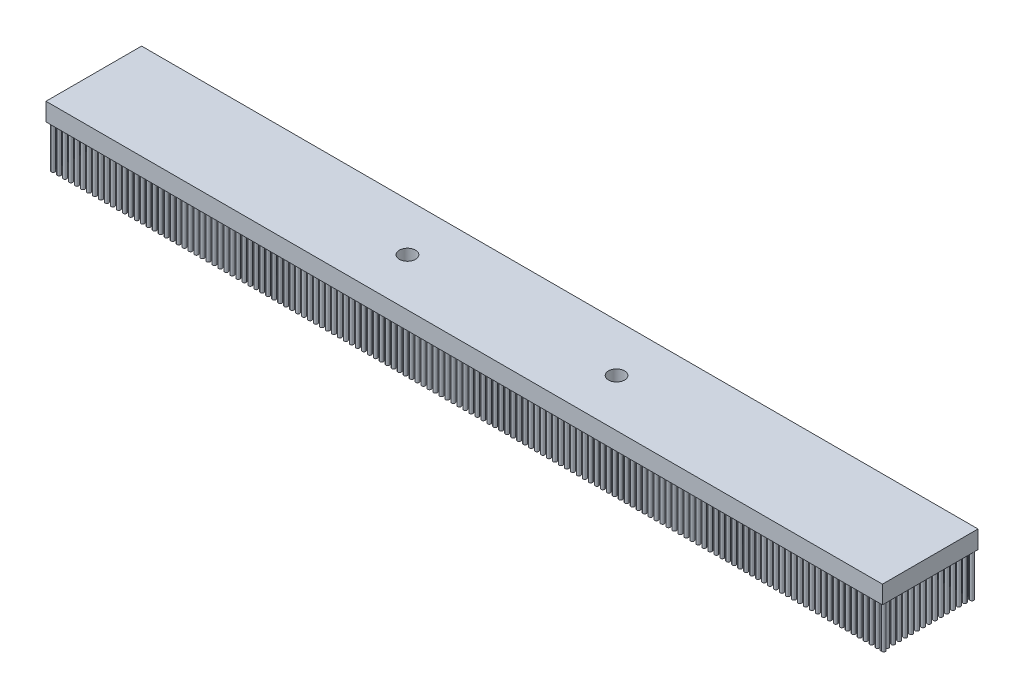
from build123d import *

# Parameters (mm, degrees)
SKETCH1_W               = 700
SKETCH1_H               = 80
BOSS_EXTRUDE1_DEPTH     = 15
SKETCH2_R               = 1.5
BOSS_EXTRUDE2_DEPTH     = 35.58
CUT_EXTRUDE1_DEPTH      = 355.070524613
CUT_EXTRUDE1_DEPTH_BACK = 355.070524613
SKETCH3_R               = 6.725


with BuildPart() as part:
    # Sketch1 → Boss-Extrude1 (new body)
    with BuildSketch(Plane(origin=(0, 0, 0), x_dir=(1, 0, 0), z_dir=(0, 1, 0))):
        Rectangle(SKETCH1_W, SKETCH1_H)
    extrude(amount=BOSS_EXTRUDE1_DEPTH)

    # Sketch2 → Boss-Extrude2 (add)
    with BuildSketch(Plane(origin=(0, 0, 0), x_dir=(1, 0, 0), z_dir=(0, 1, 0))):
        with Locations(Location((-347, 37, 0), (0, 0, 270))):
            Circle(SKETCH2_R)
        with Locations(Location((-342, 37, 0), (0, 0, 270))):
            Circle(SKETCH2_R)
        with Locations(Location((-337, 37, 0), (0, 0, 270))):
            Circle(SKETCH2_R)
        with Locations(Location((-332, 37, 0), (0, 0, 270))):
            Circle(SKETCH2_R)
        with Locations(Location((-327, 37, 0), (0, 0, 270))):
            Circle(SKETCH2_R)
        with Locations(Location((-322, 37, 0), (0, 0, 270))):
            Circle(SKETCH2_R)
        with Locations(Location((-317, 37, 0), (0, 0, 270))):
            Circle(SKETCH2_R)
        with Locations(Location((-312, 37, 0), (0, 0, 270))):
            Circle(SKETCH2_R)
        with Locations(Location((-307, 37, 0), (0, 0, 270))):
            Circle(SKETCH2_R)
        with Locations(Location((-302, 37, 0), (0, 0, 270))):
            Circle(SKETCH2_R)
        with Locations(Location((-297, 37, 0), (0, 0, 270))):
            Circle(SKETCH2_R)
        with Locations(Location((-292, 37, 0), (0, 0, 270))):
            Circle(SKETCH2_R)
        with Locations(Location((-287, 37, 0), (0, 0, 270))):
            Circle(SKETCH2_R)
        with Locations(Location((-282, 37, 0), (0, 0, 270))):
            Circle(SKETCH2_R)
        with Locations(Location((-277, 37, 0), (0, 0, 270))):
            Circle(SKETCH2_R)
        with Locations(Location((-272, 37, 0), (0, 0, 270))):
            Circle(SKETCH2_R)
        with Locations(Location((-267, 37, 0), (0, 0, 270))):
            Circle(SKETCH2_R)
        with Locations(Location((-262, 37, 0), (0, 0, 270))):
            Circle(SKETCH2_R)
        with Locations(Location((-257, 37, 0), (0, 0, 270))):
            Circle(SKETCH2_R)
        with Locations(Location((-252, 37, 0), (0, 0, 270))):
            Circle(SKETCH2_R)
        with Locations(Location((-247, 37, 0), (0, 0, 270))):
            Circle(SKETCH2_R)
        with Locations(Location((-242, 37, 0), (0, 0, 270))):
            Circle(SKETCH2_R)
        with Locations(Location((-237, 37, 0), (0, 0, 270))):
            Circle(SKETCH2_R)
        with Locations(Location((-232, 37, 0), (0, 0, 270))):
            Circle(SKETCH2_R)
        with Locations(Location((-227, 37, 0), (0, 0, 270))):
            Circle(SKETCH2_R)
        with Locations(Location((-222, 37, 0), (0, 0, 270))):
            Circle(SKETCH2_R)
        with Locations(Location((-217, 37, 0), (0, 0, 270))):
            Circle(SKETCH2_R)
        with Locations(Location((-212, 37, 0), (0, 0, 270))):
            Circle(SKETCH2_R)
        with Locations(Location((-207, 37, 0), (0, 0, 270))):
            Circle(SKETCH2_R)
        with Locations(Location((-202, 37, 0), (0, 0, 270))):
            Circle(SKETCH2_R)
        with Locations(Location((-197, 37, 0), (0, 0, 270))):
            Circle(SKETCH2_R)
        with Locations(Location((-192, 37, 0), (0, 0, 270))):
            Circle(SKETCH2_R)
        with Locations(Location((-187, 37, 0), (0, 0, 270))):
            Circle(SKETCH2_R)
        with Locations(Location((-182, 37, 0), (0, 0, 270))):
            Circle(SKETCH2_R)
        with Locations(Location((-177, 37, 0), (0, 0, 270))):
            Circle(SKETCH2_R)
        with Locations(Location((-172, 37, 0), (0, 0, 270))):
            Circle(SKETCH2_R)
        with Locations(Location((-167, 37, 0), (0, 0, 270))):
            Circle(SKETCH2_R)
        with Locations(Location((-162, 37, 0), (0, 0, 270))):
            Circle(SKETCH2_R)
        with Locations(Location((-157, 37, 0), (0, 0, 270))):
            Circle(SKETCH2_R)
        with Locations(Location((-152, 37, 0), (0, 0, 270))):
            Circle(SKETCH2_R)
        with Locations(Location((-147, 37, 0), (0, 0, 270))):
            Circle(SKETCH2_R)
        with Locations(Location((-142, 37, 0), (0, 0, 270))):
            Circle(SKETCH2_R)
        with Locations(Location((-137, 37, 0), (0, 0, 270))):
            Circle(SKETCH2_R)
        with Locations(Location((-132, 37, 0), (0, 0, 270))):
            Circle(SKETCH2_R)
        with Locations(Location((-127, 37, 0), (0, 0, 270))):
            Circle(SKETCH2_R)
        with Locations(Location((-122, 37, 0), (0, 0, 270))):
            Circle(SKETCH2_R)
        with Locations(Location((-117, 37, 0), (0, 0, 270))):
            Circle(SKETCH2_R)
        with Locations(Location((-112, 37, 0), (0, 0, 270))):
            Circle(SKETCH2_R)
        with Locations(Location((-107, 37, 0), (0, 0, 270))):
            Circle(SKETCH2_R)
        with Locations(Location((-102, 37, 0), (0, 0, 270))):
            Circle(SKETCH2_R)
        with Locations(Location((-97, 37, 0), (0, 0, 270))):
            Circle(SKETCH2_R)
        with Locations(Location((-92, 37, 0), (0, 0, 270))):
            Circle(SKETCH2_R)
        with Locations(Location((-87, 37, 0), (0, 0, 270))):
            Circle(SKETCH2_R)
        with Locations(Location((-82, 37, 0), (0, 0, 270))):
            Circle(SKETCH2_R)
        with Locations(Location((-77, 37, 0), (0, 0, 270))):
            Circle(SKETCH2_R)
        with Locations(Location((-72, 37, 0), (0, 0, 270))):
            Circle(SKETCH2_R)
        with Locations(Location((-67, 37, 0), (0, 0, 270))):
            Circle(SKETCH2_R)
        with Locations(Location((-62, 37, 0), (0, 0, 270))):
            Circle(SKETCH2_R)
        with Locations(Location((-57, 37, 0), (0, 0, 270))):
            Circle(SKETCH2_R)
        with Locations(Location((-52, 37, 0), (0, 0, 270))):
            Circle(SKETCH2_R)
        with Locations(Location((-47, 37, 0), (0, 0, 270))):
            Circle(SKETCH2_R)
        with Locations(Location((-42, 37, 0), (0, 0, 270))):
            Circle(SKETCH2_R)
        with Locations(Location((-37, 37, 0), (0, 0, 270))):
            Circle(SKETCH2_R)
        with Locations(Location((-32, 37, 0), (0, 0, 270))):
            Circle(SKETCH2_R)
        with Locations(Location((-27, 37, 0), (0, 0, 270))):
            Circle(SKETCH2_R)
        with Locations(Location((-22, 37, 0), (0, 0, 270))):
            Circle(SKETCH2_R)
        with Locations(Location((-17, 37, 0), (0, 0, 270))):
            Circle(SKETCH2_R)
        with Locations(Location((-12, 37, 0), (0, 0, 270))):
            Circle(SKETCH2_R)
        with Locations(Location((-7, 37, 0), (0, 0, 270))):
            Circle(SKETCH2_R)
        with Locations(Location((-2, 37, 0), (0, 0, 270))):
            Circle(SKETCH2_R)
        with Locations(Location((3, 37, 0), (0, 0, 270))):
            Circle(SKETCH2_R)
        with Locations(Location((8, 37, 0), (0, 0, 270))):
            Circle(SKETCH2_R)
        with Locations(Location((13, 37, 0), (0, 0, 270))):
            Circle(SKETCH2_R)
        with Locations(Location((18, 37, 0), (0, 0, 270))):
            Circle(SKETCH2_R)
        with Locations(Location((23, 37, 0), (0, 0, 270))):
            Circle(SKETCH2_R)
        with Locations(Location((28, 37, 0), (0, 0, 270))):
            Circle(SKETCH2_R)
        with Locations(Location((33, 37, 0), (0, 0, 270))):
            Circle(SKETCH2_R)
        with Locations(Location((38, 37, 0), (0, 0, 270))):
            Circle(SKETCH2_R)
        with Locations(Location((43, 37, 0), (0, 0, 270))):
            Circle(SKETCH2_R)
        with Locations(Location((48, 37, 0), (0, 0, 270))):
            Circle(SKETCH2_R)
        with Locations(Location((53, 37, 0), (0, 0, 270))):
            Circle(SKETCH2_R)
        with Locations(Location((58, 37, 0), (0, 0, 270))):
            Circle(SKETCH2_R)
        with Locations(Location((63, 37, 0), (0, 0, 270))):
            Circle(SKETCH2_R)
        with Locations(Location((68, 37, 0), (0, 0, 270))):
            Circle(SKETCH2_R)
        with Locations(Location((73, 37, 0), (0, 0, 270))):
            Circle(SKETCH2_R)
        with Locations(Location((78, 37, 0), (0, 0, 270))):
            Circle(SKETCH2_R)
        with Locations(Location((83, 37, 0), (0, 0, 270))):
            Circle(SKETCH2_R)
        with Locations(Location((88, 37, 0), (0, 0, 270))):
            Circle(SKETCH2_R)
        with Locations(Location((93, 37, 0), (0, 0, 270))):
            Circle(SKETCH2_R)
        with Locations(Location((98, 37, 0), (0, 0, 270))):
            Circle(SKETCH2_R)
        with Locations(Location((103, 37, 0), (0, 0, 270))):
            Circle(SKETCH2_R)
        with Locations(Location((108, 37, 0), (0, 0, 270))):
            Circle(SKETCH2_R)
        with Locations(Location((113, 37, 0), (0, 0, 270))):
            Circle(SKETCH2_R)
        with Locations(Location((118, 37, 0), (0, 0, 270))):
            Circle(SKETCH2_R)
        with Locations(Location((123, 37, 0), (0, 0, 270))):
            Circle(SKETCH2_R)
        with Locations(Location((128, 37, 0), (0, 0, 270))):
            Circle(SKETCH2_R)
        with Locations(Location((133, 37, 0), (0, 0, 270))):
            Circle(SKETCH2_R)
        with Locations(Location((138, 37, 0), (0, 0, 270))):
            Circle(SKETCH2_R)
        with Locations(Location((143, 37, 0), (0, 0, 270))):
            Circle(SKETCH2_R)
        with Locations(Location((148, 37, 0), (0, 0, 270))):
            Circle(SKETCH2_R)
        with Locations(Location((153, 37, 0), (0, 0, 270))):
            Circle(SKETCH2_R)
        with Locations(Location((158, 37, 0), (0, 0, 270))):
            Circle(SKETCH2_R)
        with Locations(Location((163, 37, 0), (0, 0, 270))):
            Circle(SKETCH2_R)
        with Locations(Location((168, 37, 0), (0, 0, 270))):
            Circle(SKETCH2_R)
        with Locations(Location((173, 37, 0), (0, 0, 270))):
            Circle(SKETCH2_R)
        with Locations(Location((178, 37, 0), (0, 0, 270))):
            Circle(SKETCH2_R)
        with Locations(Location((183, 37, 0), (0, 0, 270))):
            Circle(SKETCH2_R)
        with Locations(Location((188, 37, 0), (0, 0, 270))):
            Circle(SKETCH2_R)
        with Locations(Location((193, 37, 0), (0, 0, 270))):
            Circle(SKETCH2_R)
        with Locations(Location((198, 37, 0), (0, 0, 270))):
            Circle(SKETCH2_R)
        with Locations(Location((203, 37, 0), (0, 0, 270))):
            Circle(SKETCH2_R)
        with Locations(Location((208, 37, 0), (0, 0, 270))):
            Circle(SKETCH2_R)
        with Locations(Location((213, 37, 0), (0, 0, 270))):
            Circle(SKETCH2_R)
        with Locations(Location((218, 37, 0), (0, 0, 270))):
            Circle(SKETCH2_R)
        with Locations(Location((223, 37, 0), (0, 0, 270))):
            Circle(SKETCH2_R)
        with Locations(Location((228, 37, 0), (0, 0, 270))):
            Circle(SKETCH2_R)
        with Locations(Location((233, 37, 0), (0, 0, 270))):
            Circle(SKETCH2_R)
        with Locations(Location((238, 37, 0), (0, 0, 270))):
            Circle(SKETCH2_R)
        with Locations(Location((243, 37, 0), (0, 0, 270))):
            Circle(SKETCH2_R)
        with Locations(Location((248, 37, 0), (0, 0, 270))):
            Circle(SKETCH2_R)
        with Locations(Location((253, 37, 0), (0, 0, 270))):
            Circle(SKETCH2_R)
        with Locations(Location((258, 37, 0), (0, 0, 270))):
            Circle(SKETCH2_R)
        with Locations(Location((263, 37, 0), (0, 0, 270))):
            Circle(SKETCH2_R)
        with Locations(Location((268, 37, 0), (0, 0, 270))):
            Circle(SKETCH2_R)
        with Locations(Location((273, 37, 0), (0, 0, 270))):
            Circle(SKETCH2_R)
        with Locations(Location((278, 37, 0), (0, 0, 270))):
            Circle(SKETCH2_R)
        with Locations(Location((283, 37, 0), (0, 0, 270))):
            Circle(SKETCH2_R)
        with Locations(Location((288, 37, 0), (0, 0, 270))):
            Circle(SKETCH2_R)
        with Locations(Location((293, 37, 0), (0, 0, 270))):
            Circle(SKETCH2_R)
        with Locations(Location((298, 37, 0), (0, 0, 270))):
            Circle(SKETCH2_R)
        with Locations(Location((303, 37, 0), (0, 0, 270))):
            Circle(SKETCH2_R)
        with Locations(Location((308, 37, 0), (0, 0, 270))):
            Circle(SKETCH2_R)
        with Locations(Location((313, 37, 0), (0, 0, 270))):
            Circle(SKETCH2_R)
        with Locations(Location((318, 37, 0), (0, 0, 270))):
            Circle(SKETCH2_R)
        with Locations(Location((323, 37, 0), (0, 0, 270))):
            Circle(SKETCH2_R)
        with Locations(Location((328, 37, 0), (0, 0, 270))):
            Circle(SKETCH2_R)
        with Locations(Location((333, 37, 0), (0, 0, 270))):
            Circle(SKETCH2_R)
        with Locations(Location((338, 37, 0), (0, 0, 270))):
            Circle(SKETCH2_R)
        with Locations(Location((343, 37, 0), (0, 0, 270))):
            Circle(SKETCH2_R)
        with Locations((348, 37)):
            Circle(SKETCH2_R)
        with Locations(Location((-347, 32, 0), (0, 0, 270))):
            Circle(SKETCH2_R)
        with Locations(Location((-347, 27, 0), (0, 0, 270))):
            Circle(SKETCH2_R)
        with Locations(Location((-347, 22, 0), (0, 0, 270))):
            Circle(SKETCH2_R)
        with Locations(Location((-347, 17, 0), (0, 0, 270))):
            Circle(SKETCH2_R)
        with Locations(Location((-347, 12, 0), (0, 0, 270))):
            Circle(SKETCH2_R)
        with Locations(Location((-347, 7, 0), (0, 0, 270))):
            Circle(SKETCH2_R)
        with Locations(Location((-347, 2, 0), (0, 0, 270))):
            Circle(SKETCH2_R)
        with Locations(Location((-347, -3, 0), (0, 0, 270))):
            Circle(SKETCH2_R)
        with Locations(Location((-347, -8, 0), (0, 0, 270))):
            Circle(SKETCH2_R)
        with Locations(Location((-347, -13, 0), (0, 0, 270))):
            Circle(SKETCH2_R)
        with Locations(Location((-347, -18, 0), (0, 0, 270))):
            Circle(SKETCH2_R)
        with Locations(Location((-347, -23, 0), (0, 0, 270))):
            Circle(SKETCH2_R)
        with Locations(Location((-347, -28, 0), (0, 0, 270))):
            Circle(SKETCH2_R)
        with Locations(Location((-347, -33, 0), (0, 0, 270))):
            Circle(SKETCH2_R)
        with Locations((348, -37)):
            Circle(SKETCH2_R)
        with Locations(Location((343, -37, 0), (0, 0, 90))):
            Circle(SKETCH2_R)
        with Locations(Location((338, -37, 0), (0, 0, 90))):
            Circle(SKETCH2_R)
        with Locations(Location((333, -37, 0), (0, 0, 90))):
            Circle(SKETCH2_R)
        with Locations(Location((328, -37, 0), (0, 0, 90))):
            Circle(SKETCH2_R)
        with Locations(Location((323, -37, 0), (0, 0, 90))):
            Circle(SKETCH2_R)
        with Locations(Location((318, -37, 0), (0, 0, 90))):
            Circle(SKETCH2_R)
        with Locations(Location((313, -37, 0), (0, 0, 90))):
            Circle(SKETCH2_R)
        with Locations(Location((308, -37, 0), (0, 0, 90))):
            Circle(SKETCH2_R)
        with Locations(Location((303, -37, 0), (0, 0, 90))):
            Circle(SKETCH2_R)
        with Locations(Location((298, -37, 0), (0, 0, 90))):
            Circle(SKETCH2_R)
        with Locations(Location((293, -37, 0), (0, 0, 90))):
            Circle(SKETCH2_R)
        with Locations(Location((288, -37, 0), (0, 0, 90))):
            Circle(SKETCH2_R)
        with Locations(Location((283, -37, 0), (0, 0, 90))):
            Circle(SKETCH2_R)
        with Locations(Location((278, -37, 0), (0, 0, 90))):
            Circle(SKETCH2_R)
        with Locations(Location((273, -37, 0), (0, 0, 90))):
            Circle(SKETCH2_R)
        with Locations(Location((268, -37, 0), (0, 0, 90))):
            Circle(SKETCH2_R)
        with Locations(Location((263, -37, 0), (0, 0, 90))):
            Circle(SKETCH2_R)
        with Locations(Location((258, -37, 0), (0, 0, 90))):
            Circle(SKETCH2_R)
        with Locations(Location((253, -37, 0), (0, 0, 90))):
            Circle(SKETCH2_R)
        with Locations(Location((248, -37, 0), (0, 0, 90))):
            Circle(SKETCH2_R)
        with Locations(Location((243, -37, 0), (0, 0, 90))):
            Circle(SKETCH2_R)
        with Locations(Location((238, -37, 0), (0, 0, 90))):
            Circle(SKETCH2_R)
        with Locations(Location((233, -37, 0), (0, 0, 90))):
            Circle(SKETCH2_R)
        with Locations(Location((228, -37, 0), (0, 0, 90))):
            Circle(SKETCH2_R)
        with Locations(Location((223, -37, 0), (0, 0, 90))):
            Circle(SKETCH2_R)
        with Locations(Location((218, -37, 0), (0, 0, 90))):
            Circle(SKETCH2_R)
        with Locations(Location((213, -37, 0), (0, 0, 90))):
            Circle(SKETCH2_R)
        with Locations(Location((208, -37, 0), (0, 0, 90))):
            Circle(SKETCH2_R)
        with Locations(Location((203, -37, 0), (0, 0, 90))):
            Circle(SKETCH2_R)
        with Locations(Location((198, -37, 0), (0, 0, 90))):
            Circle(SKETCH2_R)
        with Locations(Location((193, -37, 0), (0, 0, 90))):
            Circle(SKETCH2_R)
        with Locations(Location((188, -37, 0), (0, 0, 90))):
            Circle(SKETCH2_R)
        with Locations(Location((183, -37, 0), (0, 0, 90))):
            Circle(SKETCH2_R)
        with Locations(Location((178, -37, 0), (0, 0, 90))):
            Circle(SKETCH2_R)
        with Locations(Location((173, -37, 0), (0, 0, 90))):
            Circle(SKETCH2_R)
        with Locations(Location((168, -37, 0), (0, 0, 90))):
            Circle(SKETCH2_R)
        with Locations(Location((163, -37, 0), (0, 0, 90))):
            Circle(SKETCH2_R)
        with Locations(Location((158, -37, 0), (0, 0, 90))):
            Circle(SKETCH2_R)
        with Locations(Location((153, -37, 0), (0, 0, 90))):
            Circle(SKETCH2_R)
        with Locations(Location((148, -37, 0), (0, 0, 90))):
            Circle(SKETCH2_R)
        with Locations(Location((143, -37, 0), (0, 0, 90))):
            Circle(SKETCH2_R)
        with Locations(Location((138, -37, 0), (0, 0, 90))):
            Circle(SKETCH2_R)
        with Locations(Location((133, -37, 0), (0, 0, 90))):
            Circle(SKETCH2_R)
        with Locations(Location((128, -37, 0), (0, 0, 90))):
            Circle(SKETCH2_R)
        with Locations(Location((123, -37, 0), (0, 0, 90))):
            Circle(SKETCH2_R)
        with Locations(Location((118, -37, 0), (0, 0, 90))):
            Circle(SKETCH2_R)
        with Locations(Location((113, -37, 0), (0, 0, 90))):
            Circle(SKETCH2_R)
        with Locations(Location((108, -37, 0), (0, 0, 90))):
            Circle(SKETCH2_R)
        with Locations(Location((103, -37, 0), (0, 0, 90))):
            Circle(SKETCH2_R)
        with Locations(Location((98, -37, 0), (0, 0, 90))):
            Circle(SKETCH2_R)
        with Locations(Location((93, -37, 0), (0, 0, 90))):
            Circle(SKETCH2_R)
        with Locations(Location((88, -37, 0), (0, 0, 90))):
            Circle(SKETCH2_R)
        with Locations(Location((83, -37, 0), (0, 0, 90))):
            Circle(SKETCH2_R)
        with Locations(Location((78, -37, 0), (0, 0, 90))):
            Circle(SKETCH2_R)
        with Locations(Location((73, -37, 0), (0, 0, 90))):
            Circle(SKETCH2_R)
        with Locations(Location((68, -37, 0), (0, 0, 90))):
            Circle(SKETCH2_R)
        with Locations(Location((63, -37, 0), (0, 0, 90))):
            Circle(SKETCH2_R)
        with Locations(Location((58, -37, 0), (0, 0, 90))):
            Circle(SKETCH2_R)
        with Locations(Location((53, -37, 0), (0, 0, 90))):
            Circle(SKETCH2_R)
        with Locations(Location((48, -37, 0), (0, 0, 90))):
            Circle(SKETCH2_R)
        with Locations(Location((43, -37, 0), (0, 0, 90))):
            Circle(SKETCH2_R)
        with Locations(Location((38, -37, 0), (0, 0, 90))):
            Circle(SKETCH2_R)
        with Locations(Location((33, -37, 0), (0, 0, 90))):
            Circle(SKETCH2_R)
        with Locations(Location((28, -37, 0), (0, 0, 90))):
            Circle(SKETCH2_R)
        with Locations(Location((23, -37, 0), (0, 0, 90))):
            Circle(SKETCH2_R)
        with Locations(Location((18, -37, 0), (0, 0, 90))):
            Circle(SKETCH2_R)
        with Locations(Location((13, -37, 0), (0, 0, 90))):
            Circle(SKETCH2_R)
        with Locations(Location((8, -37, 0), (0, 0, 90))):
            Circle(SKETCH2_R)
        with Locations(Location((3, -37, 0), (0, 0, 90))):
            Circle(SKETCH2_R)
        with Locations(Location((-2, -37, 0), (0, 0, 90))):
            Circle(SKETCH2_R)
        with Locations(Location((-7, -37, 0), (0, 0, 90))):
            Circle(SKETCH2_R)
        with Locations(Location((-12, -37, 0), (0, 0, 90))):
            Circle(SKETCH2_R)
        with Locations(Location((-17, -37, 0), (0, 0, 90))):
            Circle(SKETCH2_R)
        with Locations(Location((-22, -37, 0), (0, 0, 90))):
            Circle(SKETCH2_R)
        with Locations(Location((-27, -37, 0), (0, 0, 90))):
            Circle(SKETCH2_R)
        with Locations(Location((-32, -37, 0), (0, 0, 90))):
            Circle(SKETCH2_R)
        with Locations(Location((-37, -37, 0), (0, 0, 90))):
            Circle(SKETCH2_R)
        with Locations(Location((-42, -37, 0), (0, 0, 90))):
            Circle(SKETCH2_R)
        with Locations(Location((-47, -37, 0), (0, 0, 90))):
            Circle(SKETCH2_R)
        with Locations(Location((-52, -37, 0), (0, 0, 90))):
            Circle(SKETCH2_R)
        with Locations(Location((-57, -37, 0), (0, 0, 90))):
            Circle(SKETCH2_R)
        with Locations(Location((-62, -37, 0), (0, 0, 90))):
            Circle(SKETCH2_R)
        with Locations(Location((-67, -37, 0), (0, 0, 90))):
            Circle(SKETCH2_R)
        with Locations(Location((-72, -37, 0), (0, 0, 90))):
            Circle(SKETCH2_R)
        with Locations(Location((-77, -37, 0), (0, 0, 90))):
            Circle(SKETCH2_R)
        with Locations(Location((-82, -37, 0), (0, 0, 90))):
            Circle(SKETCH2_R)
        with Locations(Location((-87, -37, 0), (0, 0, 90))):
            Circle(SKETCH2_R)
        with Locations(Location((-92, -37, 0), (0, 0, 90))):
            Circle(SKETCH2_R)
        with Locations(Location((-97, -37, 0), (0, 0, 90))):
            Circle(SKETCH2_R)
        with Locations(Location((-102, -37, 0), (0, 0, 90))):
            Circle(SKETCH2_R)
        with Locations(Location((-107, -37, 0), (0, 0, 90))):
            Circle(SKETCH2_R)
        with Locations(Location((-112, -37, 0), (0, 0, 90))):
            Circle(SKETCH2_R)
        with Locations(Location((-117, -37, 0), (0, 0, 90))):
            Circle(SKETCH2_R)
        with Locations(Location((-122, -37, 0), (0, 0, 90))):
            Circle(SKETCH2_R)
        with Locations(Location((-127, -37, 0), (0, 0, 90))):
            Circle(SKETCH2_R)
        with Locations(Location((-132, -37, 0), (0, 0, 90))):
            Circle(SKETCH2_R)
        with Locations(Location((-137, -37, 0), (0, 0, 90))):
            Circle(SKETCH2_R)
        with Locations(Location((-142, -37, 0), (0, 0, 90))):
            Circle(SKETCH2_R)
        with Locations(Location((-147, -37, 0), (0, 0, 90))):
            Circle(SKETCH2_R)
        with Locations(Location((-152, -37, 0), (0, 0, 90))):
            Circle(SKETCH2_R)
        with Locations(Location((-157, -37, 0), (0, 0, 90))):
            Circle(SKETCH2_R)
        with Locations(Location((-162, -37, 0), (0, 0, 90))):
            Circle(SKETCH2_R)
        with Locations(Location((-167, -37, 0), (0, 0, 90))):
            Circle(SKETCH2_R)
        with Locations(Location((-172, -37, 0), (0, 0, 90))):
            Circle(SKETCH2_R)
        with Locations(Location((-177, -37, 0), (0, 0, 90))):
            Circle(SKETCH2_R)
        with Locations(Location((-182, -37, 0), (0, 0, 90))):
            Circle(SKETCH2_R)
        with Locations(Location((-187, -37, 0), (0, 0, 90))):
            Circle(SKETCH2_R)
        with Locations(Location((-192, -37, 0), (0, 0, 90))):
            Circle(SKETCH2_R)
        with Locations(Location((-197, -37, 0), (0, 0, 90))):
            Circle(SKETCH2_R)
        with Locations(Location((-202, -37, 0), (0, 0, 90))):
            Circle(SKETCH2_R)
        with Locations(Location((-207, -37, 0), (0, 0, 90))):
            Circle(SKETCH2_R)
        with Locations(Location((-212, -37, 0), (0, 0, 90))):
            Circle(SKETCH2_R)
        with Locations(Location((-217, -37, 0), (0, 0, 90))):
            Circle(SKETCH2_R)
        with Locations(Location((-222, -37, 0), (0, 0, 90))):
            Circle(SKETCH2_R)
        with Locations(Location((-227, -37, 0), (0, 0, 90))):
            Circle(SKETCH2_R)
        with Locations(Location((-232, -37, 0), (0, 0, 90))):
            Circle(SKETCH2_R)
        with Locations(Location((-237, -37, 0), (0, 0, 90))):
            Circle(SKETCH2_R)
        with Locations(Location((-242, -37, 0), (0, 0, 90))):
            Circle(SKETCH2_R)
        with Locations(Location((-247, -37, 0), (0, 0, 90))):
            Circle(SKETCH2_R)
        with Locations(Location((-252, -37, 0), (0, 0, 90))):
            Circle(SKETCH2_R)
        with Locations(Location((-257, -37, 0), (0, 0, 90))):
            Circle(SKETCH2_R)
        with Locations(Location((-262, -37, 0), (0, 0, 90))):
            Circle(SKETCH2_R)
        with Locations(Location((-267, -37, 0), (0, 0, 90))):
            Circle(SKETCH2_R)
        with Locations(Location((-272, -37, 0), (0, 0, 90))):
            Circle(SKETCH2_R)
        with Locations(Location((-277, -37, 0), (0, 0, 90))):
            Circle(SKETCH2_R)
        with Locations(Location((-282, -37, 0), (0, 0, 90))):
            Circle(SKETCH2_R)
        with Locations(Location((-287, -37, 0), (0, 0, 90))):
            Circle(SKETCH2_R)
        with Locations(Location((-292, -37, 0), (0, 0, 90))):
            Circle(SKETCH2_R)
        with Locations(Location((-297, -37, 0), (0, 0, 90))):
            Circle(SKETCH2_R)
        with Locations(Location((-302, -37, 0), (0, 0, 90))):
            Circle(SKETCH2_R)
        with Locations(Location((-307, -37, 0), (0, 0, 90))):
            Circle(SKETCH2_R)
        with Locations(Location((-312, -37, 0), (0, 0, 90))):
            Circle(SKETCH2_R)
        with Locations(Location((-317, -37, 0), (0, 0, 90))):
            Circle(SKETCH2_R)
        with Locations(Location((-322, -37, 0), (0, 0, 90))):
            Circle(SKETCH2_R)
        with Locations(Location((-327, -37, 0), (0, 0, 90))):
            Circle(SKETCH2_R)
        with Locations(Location((-332, -37, 0), (0, 0, 90))):
            Circle(SKETCH2_R)
        with Locations(Location((-337, -37, 0), (0, 0, 90))):
            Circle(SKETCH2_R)
        with Locations(Location((-342, -37, 0), (0, 0, 90))):
            Circle(SKETCH2_R)
        with Locations(Location((-347, -37, 0), (0, 0, 90))):
            Circle(SKETCH2_R)
        with Locations((347, -37)):
            Circle(SKETCH2_R)
        with Locations(Location((347, -33, 0), (0, 0, 90))):
            Circle(SKETCH2_R)
        with Locations(Location((347, -28, 0), (0, 0, 90))):
            Circle(SKETCH2_R)
        with Locations(Location((347, -23, 0), (0, 0, 90))):
            Circle(SKETCH2_R)
        with Locations(Location((347, -18, 0), (0, 0, 90))):
            Circle(SKETCH2_R)
        with Locations(Location((347, -13, 0), (0, 0, 90))):
            Circle(SKETCH2_R)
        with Locations(Location((347, -8, 0), (0, 0, 90))):
            Circle(SKETCH2_R)
        with Locations(Location((347, -3, 0), (0, 0, 90))):
            Circle(SKETCH2_R)
        with Locations(Location((347, 2, 0), (0, 0, 90))):
            Circle(SKETCH2_R)
        with Locations(Location((347, 7, 0), (0, 0, 90))):
            Circle(SKETCH2_R)
        with Locations(Location((347, 12, 0), (0, 0, 90))):
            Circle(SKETCH2_R)
        with Locations(Location((347, 17, 0), (0, 0, 90))):
            Circle(SKETCH2_R)
        with Locations(Location((347, 22, 0), (0, 0, 90))):
            Circle(SKETCH2_R)
        with Locations(Location((347, 27, 0), (0, 0, 90))):
            Circle(SKETCH2_R)
        with Locations(Location((347, 32, 0), (0, 0, 90))):
            Circle(SKETCH2_R)
        with Locations((347, 37)):
            Circle(SKETCH2_R)
    extrude(amount=-BOSS_EXTRUDE2_DEPTH)

    # Sketch3 → Cut-Extrude1 (cut, two sides: drawn at the far end of the back side and taken through both)
    with BuildSketch(Plane(origin=(0, 0, 0), x_dir=(1, 0, 0), z_dir=(0, 1, 0)).offset(-CUT_EXTRUDE1_DEPTH_BACK)):
        with Locations(Location((-87.5, 0, 0), (0, 0, 270))):
            Circle(SKETCH3_R)
        with Locations(Location((87.5, 0, 0), (0, 0, 270))):
            Circle(SKETCH3_R)
    extrude(amount=CUT_EXTRUDE1_DEPTH + CUT_EXTRUDE1_DEPTH_BACK, mode=Mode.SUBTRACT)


solid = part.part
